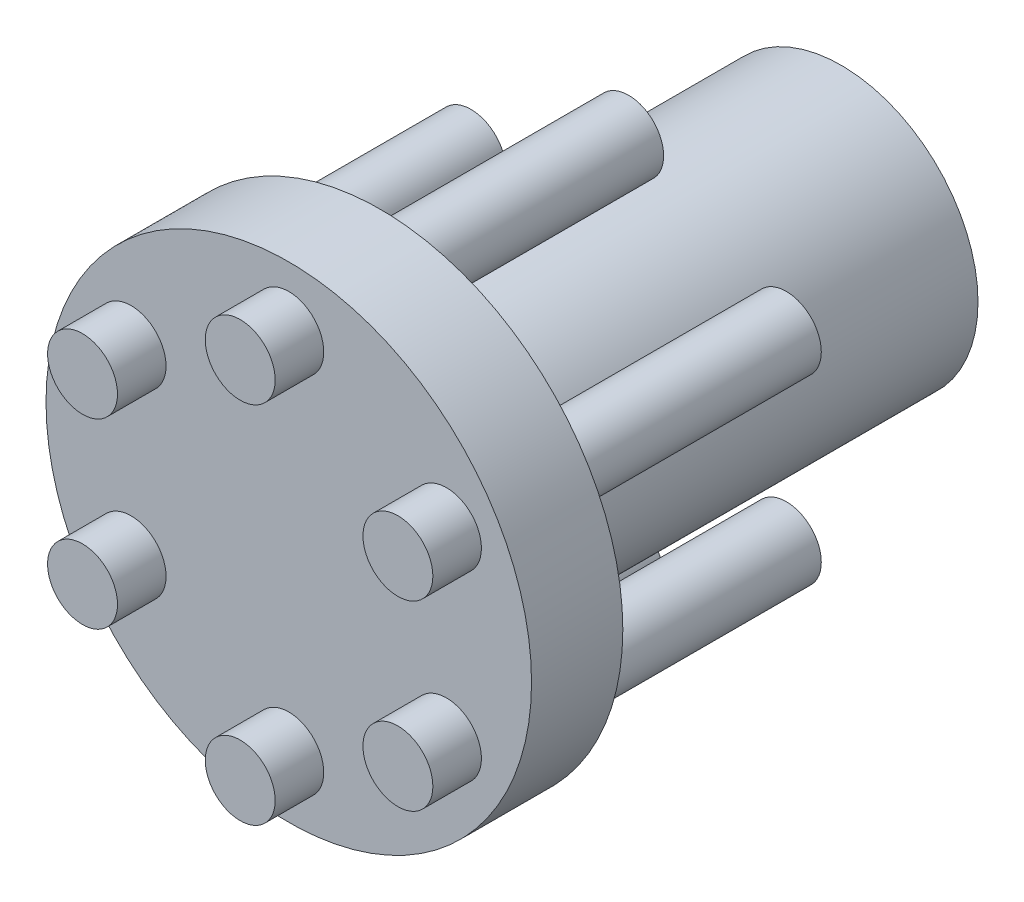
from build123d import *

# Parameters (mm, degrees)
SKETCH1_R                = 12.7
BOSS_EXTRUDE1_DEPTH      = 4.7752
SKETCH2_R                = 7.1501
BOSS_EXTRUDE2_DEPTH      = 24.13
BOSS_EXTRUDE3_DEPTH      = 2.54
BOSS_EXTRUDE3_DEPTH_BACK = 17.78
SKETCH3_R                = 1.8288


with BuildPart() as part:
    # Sketch1 → Boss-Extrude1 (new body)
    with BuildSketch(Plane.XY):
        Circle(SKETCH1_R)
    extrude(amount=BOSS_EXTRUDE1_DEPTH)

    # Sketch2 → Boss-Extrude2 (add)
    with BuildSketch(Plane(origin=(0, 0, 0), x_dir=(-1, 0, 0), z_dir=(0, 0, -1))):
        Circle(SKETCH2_R)
    extrude(amount=BOSS_EXTRUDE2_DEPTH)

    # Sketch3 → Boss-Extrude3 (add, two sides: drawn at the far end of the back side and taken through both)
    with BuildSketch(Plane.XY.offset(4.7752).offset(-BOSS_EXTRUDE3_DEPTH_BACK)):
        with Locations((0, 9.525)):
            Circle(SKETCH3_R)
        with Locations((8.248891971, 4.7625)):
            Circle(SKETCH3_R)
        with Locations((8.248891971, -4.7625)):
            Circle(SKETCH3_R)
        with Locations((0, -9.525)):
            Circle(SKETCH3_R)
        with Locations((-8.248891971, -4.7625)):
            Circle(SKETCH3_R)
        with Locations((-8.248891971, 4.7625)):
            Circle(SKETCH3_R)
    extrude(amount=BOSS_EXTRUDE3_DEPTH + BOSS_EXTRUDE3_DEPTH_BACK)


solid = part.part
